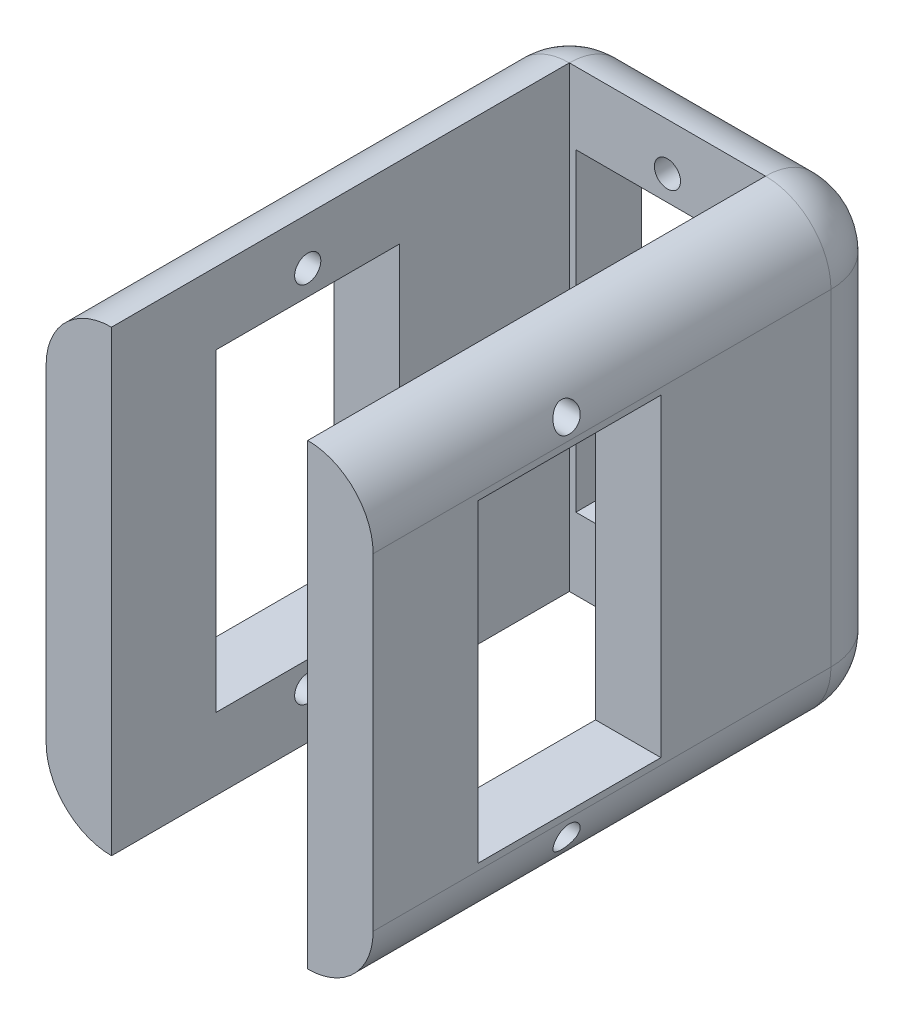
from build123d import *

# Parameters (mm, degrees)
SKETCH1_W               = 20
SKETCH1_H               = 35
SKETCH1_R               = 1
SKETCH1_W_2             = 14
SKETCH1_H_2             = 24
BOSS_EXTRUDE1_DEPTH     = 5
SKETCH2_W               = 40
SKETCH2_H               = 35
BOSS_EXTRUDE2_DEPTH     = 2.5
CUT_EXTRUDE3_DEPTH      = 49.023431781
CUT_EXTRUDE3_DEPTH_BACK = 49.023431781
SKETCH3_W               = 14
SKETCH3_H               = 24
SKETCH3_R               = 1
FILLET1_R               = 5


with BuildPart() as part:
    # Sketch1 → Boss-Extrude1 (new body)
    with BuildSketch(Plane.XY):
        Rectangle(SKETCH1_W, SKETCH1_H)
        with Locations((0, 13.9)):
            Circle(SKETCH1_R, mode=Mode.SUBTRACT)
        with Locations(Location((0, -13.9, 0), (0, 0, 180))):
            Circle(SKETCH1_R, mode=Mode.SUBTRACT)
        Rectangle(SKETCH1_W_2, SKETCH1_H_2, mode=Mode.SUBTRACT)
    extrude(amount=BOSS_EXTRUDE1_DEPTH)

    # Sketch2 → Boss-Extrude2 (add, symmetric)
    with BuildSketch(Plane.ZY.offset(10)):
        with Locations((20, 0)):
            Rectangle(SKETCH2_W, SKETCH2_H)
    boss_extrude2 = extrude(amount=BOSS_EXTRUDE2_DEPTH, both=True)

    # Mirror3: Boss-Extrude2 across plane
    add(boss_extrude2.mirror(Plane(origin=(0, 0, 0), x_dir=(0, 0, 1), z_dir=(1, 0, 0))))

    # Sketch3 → Cut-Extrude3 (cut, two sides: drawn at the far end of the back side and taken through both)
    with BuildSketch(Plane(origin=(-7.5, 0, 0), x_dir=(0, 0, -1), z_dir=(1, 0, 0)).offset(-CUT_EXTRUDE3_DEPTH_BACK)):
        with Locations((-25, 0)):
            Rectangle(SKETCH3_W, SKETCH3_H)
        with Locations((-25, -13.9)):
            Circle(SKETCH3_R)
        with Locations((-25, 13.9)):
            Circle(SKETCH3_R)
    extrude(amount=CUT_EXTRUDE3_DEPTH + CUT_EXTRUDE3_DEPTH_BACK, mode=Mode.SUBTRACT)

    # Fillet1
    # the kernel refuses this fillet: 5 mm, written as the material it takes off along each edge
    with BuildSketch(Plane(origin=(-7.5, -12.5, 5), x_dir=(0, 0, -1), z_dir=(0, -1, 0))) as fillet1_piece_1_section:
        Polygon((0, 0), (FILLET1_R, 0), (FILLET1_R, -FILLET1_R), (0, -FILLET1_R), align=None)
    fillet1_piece_1 = extrude(amount=FILLET1_R, mode=Mode.PRIVATE)
    fillet1_piece_1 = fillet1_piece_1 - Plane(origin=(-7.5, -12.5, 5), x_dir=(0.7071067811865475, 0, 0.7071067811865475), z_dir=(0, -1, 0)) * Sphere(FILLET1_R, mode=Mode.PRIVATE)
    add(fillet1_piece_1, mode=Mode.SUBTRACT)
    with BuildSketch(Plane(origin=(7.5, -12.5, 5), x_dir=(0, 0, -1), z_dir=(0, -1, 0))) as fillet1_piece_2_section:
        Polygon((0, 0), (FILLET1_R, 0), (FILLET1_R, FILLET1_R), (0, FILLET1_R), align=None)
    fillet1_piece_2 = extrude(amount=FILLET1_R, mode=Mode.PRIVATE)
    fillet1_piece_2 = fillet1_piece_2 - Plane(origin=(7.5, -12.5, 5), x_dir=(-0.7071067811865475, 0, 0.7071067811865475), z_dir=(0, -1, 0)) * Sphere(FILLET1_R, mode=Mode.PRIVATE)
    add(fillet1_piece_2, mode=Mode.SUBTRACT)
    with BuildSketch(Plane(origin=(-7.5, 12.5, 5), x_dir=(-1, 0, 0), z_dir=(0, 0, -1))) as fillet1_piece_3_section:
        Polygon((0, 0), (FILLET1_R, 0), (FILLET1_R, FILLET1_R), (0, FILLET1_R), align=None)
    fillet1_piece_3 = extrude(amount=FILLET1_R, mode=Mode.PRIVATE)
    fillet1_piece_3 = fillet1_piece_3 - Plane(origin=(-7.5, 12.5, 5), x_dir=(0.7071067811865475, -0.7071067811865475, 0), z_dir=(0, 0, -1)) * Sphere(FILLET1_R, mode=Mode.PRIVATE)
    add(fillet1_piece_3, mode=Mode.SUBTRACT)
    with BuildSketch(Plane(origin=(7.5, 12.5, 5), x_dir=(0, 0, -1), z_dir=(1, 0, 0))) as fillet1_piece_4_section:
        Polygon((0, 0), (FILLET1_R, 0), (FILLET1_R, FILLET1_R), (0, FILLET1_R), align=None)
    fillet1_piece_4 = extrude(amount=FILLET1_R, mode=Mode.PRIVATE)
    fillet1_piece_4 = fillet1_piece_4 - Plane(origin=(7.5, 12.5, 5), x_dir=(0, -0.7071067811865475, 0.7071067811865475), z_dir=(1, 0, 0)) * Sphere(FILLET1_R, mode=Mode.PRIVATE)
    add(fillet1_piece_4, mode=Mode.SUBTRACT)
    with BuildSketch(Plane(origin=(-7.5, -17.5, 0), x_dir=(0, 0, 1), z_dir=(1, 0, 0)), Plane(origin=(-7.5, 17.5, 0), x_dir=(0, -1, 0), z_dir=(1, 0, 0))) as fillet1_piece_5:
        with BuildLine():
            CenterArc((FILLET1_R, -FILLET1_R), FILLET1_R, 90, 90)
            Line((0, -FILLET1_R), (0, 0))
            Line((0, 0), (FILLET1_R, 0))
        make_face()
    extrude(amount=15, mode=Mode.SUBTRACT)
    with BuildSketch(Plane(origin=(-12.5, 17.5, 5), x_dir=(0, -1, 0), z_dir=(0, 0, 1)), Plane(origin=(12.5, -17.5, 52.5), x_dir=(-1, 0, 0), z_dir=(0, 0, -1))) as fillet1_piece_6:
        with BuildLine():
            CenterArc((FILLET1_R, FILLET1_R), FILLET1_R, 180, 90)
            Line((0, FILLET1_R), (0, 0))
            Line((0, 0), (FILLET1_R, 0))
        make_face()
    extrude(amount=47.5, mode=Mode.SUBTRACT)
    with BuildSketch(Plane(origin=(-12.5, -17.5, 52.5), x_dir=(1, 0, 0), z_dir=(0, 0, -1)), Plane(origin=(12.5, 17.5, 5), x_dir=(0, -1, 0), z_dir=(0, 0, 1))) as fillet1_piece_7:
        with BuildLine():
            CenterArc((FILLET1_R, -FILLET1_R), FILLET1_R, 90, 90)
            Line((0, -FILLET1_R), (0, 0))
            Line((0, 0), (FILLET1_R, 0))
        make_face()
    extrude(amount=47.5, mode=Mode.SUBTRACT)
    with BuildSketch(Plane(origin=(12.5, -12.5, 0), x_dir=(-1, 0, 0), z_dir=(0, 1, 0))) as fillet1_piece_8:
        with BuildLine():
            CenterArc((FILLET1_R, FILLET1_R), FILLET1_R, 180, 90)
            Line((0, FILLET1_R), (0, 0))
            Line((0, 0), (FILLET1_R, 0))
        make_face()
    extrude(amount=25, mode=Mode.SUBTRACT)
    with BuildSketch(Plane(origin=(-12.5, -12.5, 0), x_dir=(1, 0, 0), z_dir=(0, 1, 0))) as fillet1_piece_9:
        with BuildLine():
            CenterArc((FILLET1_R, -FILLET1_R), FILLET1_R, 90, 90)
            Line((0, -FILLET1_R), (0, 0))
            Line((0, 0), (FILLET1_R, 0))
        make_face()
    extrude(amount=25, mode=Mode.SUBTRACT)


solid = part.part
